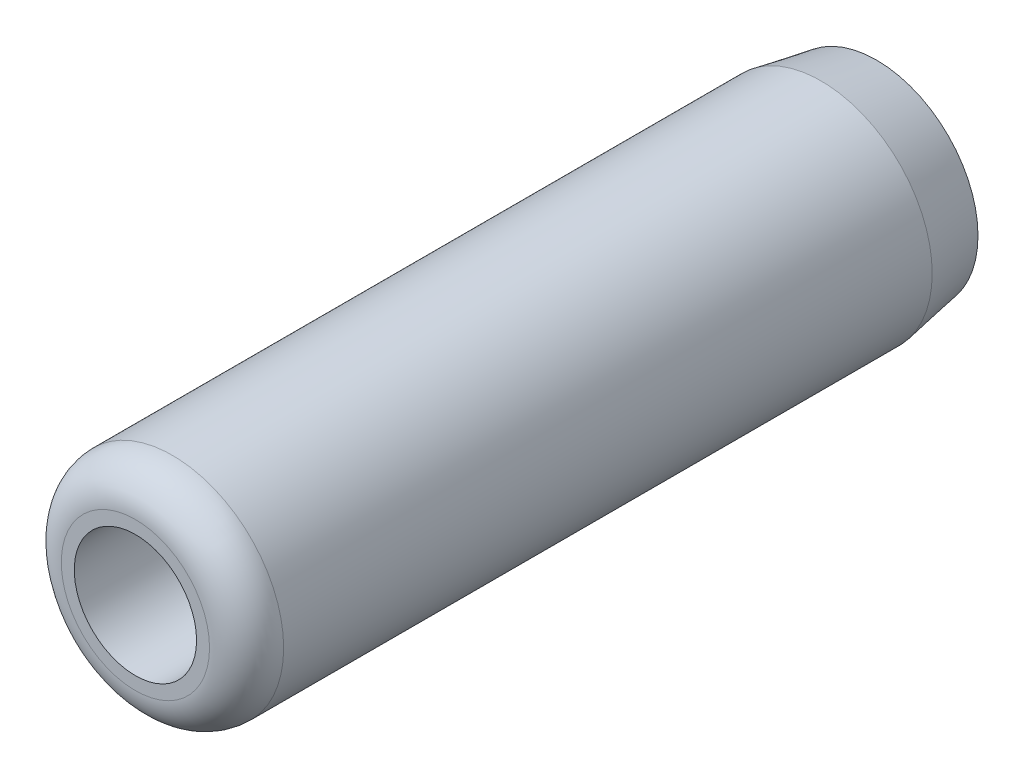
from build123d import *

# Parameters (mm, degrees)
HOLE_WIZARD_M4_1_D = 3.3


with BuildPart() as part:
    # ｽｹｯﾁ1 → 回転1 (revolve)
    with BuildSketch(Plane(origin=(0, 0, 0), x_dir=(0, 0, -1), z_dir=(1, 0, 0))):
        with BuildLine():
            Line((0, 0), (0, 2))
            ThreePointArc((0, 2), (0.292893219, 2.707106781), (1, 3))
            Line((1, 3), (18.5, 3))
            Line((18.5, 3), (20, 2.735509529))
            Line((20, 2.735509529), (20, 0))
            Line((20, 0), (0, 0))
        make_face()
    revolve(axis=Axis((0, 0, 0), (0, 0, -1)))

    # M4 ねじ穴1 (through all)
    with Locations(Plane.XY):
        with Locations((0, 0)):
            Hole(HOLE_WIZARD_M4_1_D / 2)


solid = part.part
